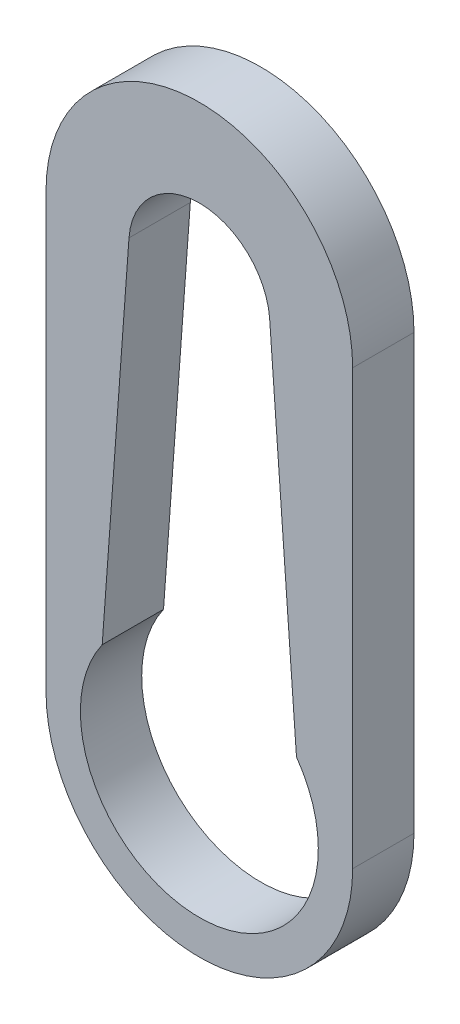
from build123d import *

# Parameters (mm, degrees)
BOSS_EXTRUDE1_DEPTH = 2


with BuildPart() as part:
    # Sketch1 → Boss-Extrude1 (new body)
    with BuildSketch(Plane.XY):
        with BuildLine():
            Line((75.585447554, 74.077647485), (75.585447554, 59.931475915))
            ThreePointArc((75.585447554, 59.931475915), (80.585447554, 54.931475915), (85.585447554, 59.931475915))
            Line((85.585447554, 59.931475915), (85.585447554, 74.077647485))
            ThreePointArc((85.585447554, 74.077647485), (80.585447554, 79.077647485), (75.585447554, 74.077647485))
        make_face()
        with BuildLine():
            Line((77.417478776, 62.171649257), (78.291593741, 74.09957403))
            ThreePointArc((78.291593741, 74.09957403), (80.585438483, 76.231471338), (82.879285937, 74.099576949))
            Line((82.879285937, 74.099576949), (83.753416376, 62.171649257))
            ThreePointArc((83.753416376, 62.171649257), (80.585447576, 56.052944097), (77.417478776, 62.171649257))
        make_face(mode=Mode.SUBTRACT)
    extrude(amount=BOSS_EXTRUDE1_DEPTH)


solid = part.part
